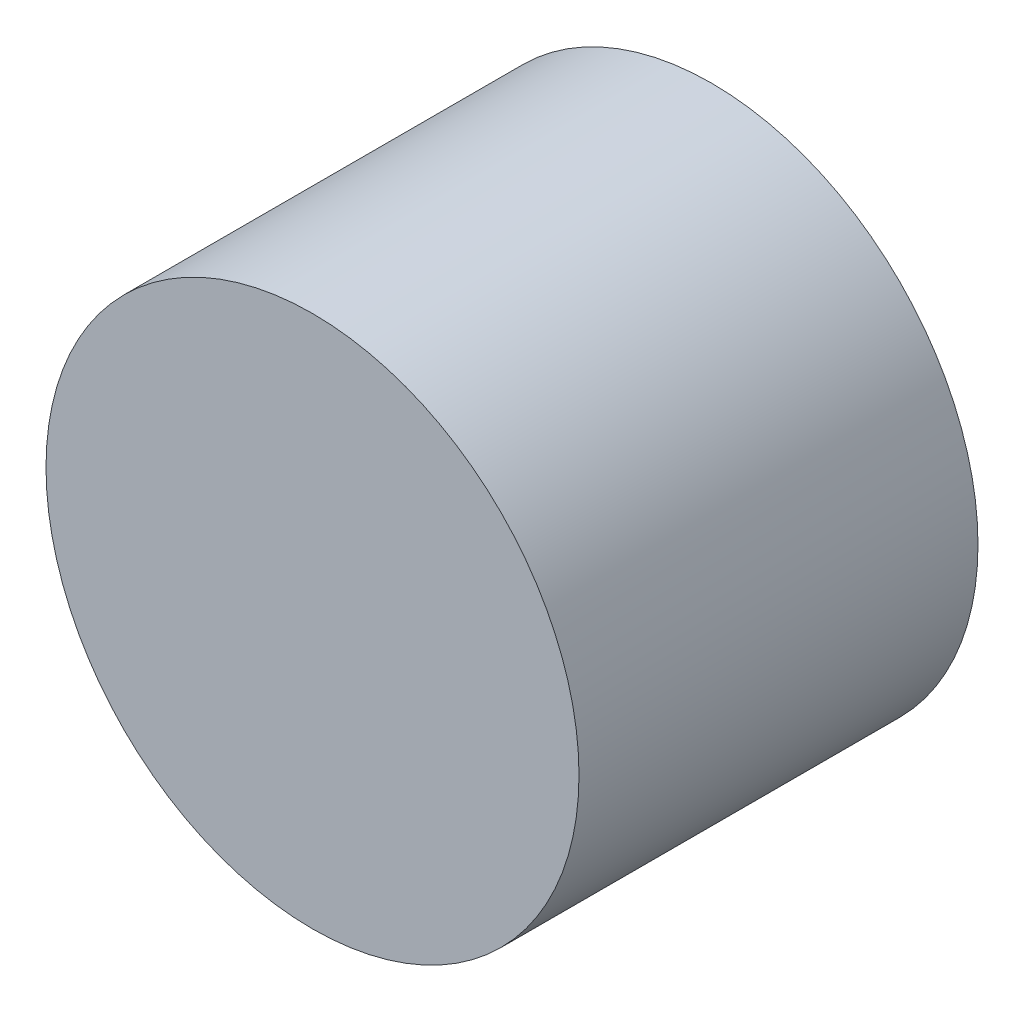
from build123d import *

# Parameters (mm, degrees)
SKETCH1_R           = 35
BOSS_EXTRUDE1_DEPTH = 52.4


with BuildPart() as part:
    # Sketch1 → Boss-Extrude1 (new body)
    with BuildSketch(Plane(origin=(0, 0, 0), x_dir=(0, 1, 0), z_dir=(0, 0, 1))):
        Circle(SKETCH1_R)
    extrude(amount=BOSS_EXTRUDE1_DEPTH)


solid = part.part
